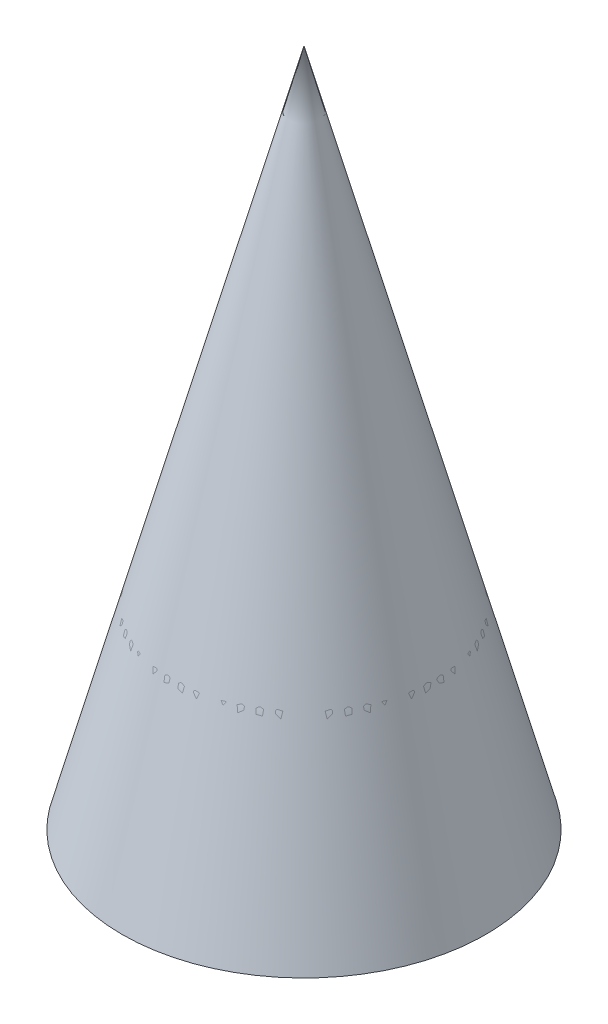
from build123d import *


with BuildPart() as part:
    # 草图1 → 旋转1 (revolve)
    with BuildSketch(Plane.XY):
        Polygon((0, 0), (0, 150), (40.192378865, 0), align=None)
    revolve(axis=Axis((0, 118.33598762, 0), (0, -1, 0)))

    # 草图2 → 切除-旋转1 (revolve, cut)
    with BuildSketch(Plane.XY):
        with BuildLine():
            Line((0, 107.039450423), (0, 77.049450423))
            ThreePointArc((0, 77.049450423), (14.995, 92.044450423), (0, 107.039450423))
        make_face()
        with BuildLine():
            Line((0, 64.083900845), (0, 4.093900845))
            ThreePointArc((0, 4.093900845), (29.995, 34.088900845), (0, 64.083900845))
        make_face()
    revolve(axis=Axis((0, 150, 0), (0, -1, 0)), mode=Mode.SUBTRACT)


solid = part.part
